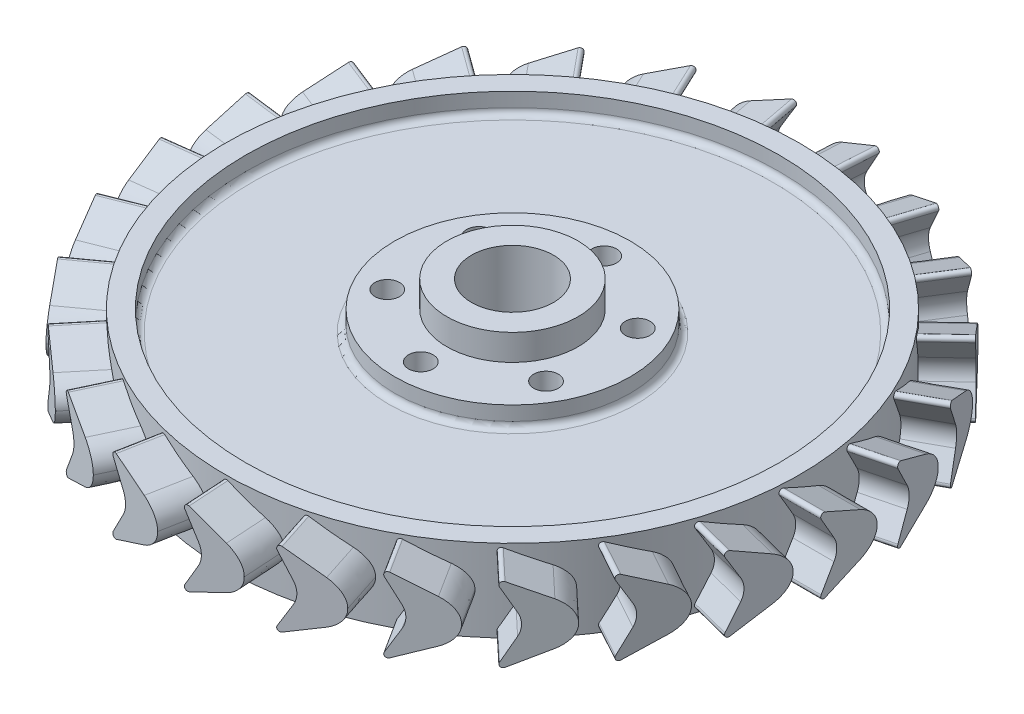
from build123d import *

# Parameters (mm, degrees)
HUB_FILLETS_R          = 0.762
F_4_0MM_DOWEL_HOLE1_D  = 3
CIRPATTERN1_COUNT      = 6
F_10_0MM_DOWEL_HOLE1_D = 10
BOSS_EXTRUDE2_START    = -2.5
BOSS_EXTRUDE2_DEPTH    = 7.5
FILLET1_R              = 0.381
CIRPATTERN3_START      = 34.716323972
CIRPATTERN3_DEPTH      = 5.283676028
CIRPATTERN3_2_DEPTH    = 5.283676028
CIRPATTERN3_3_DEPTH    = 5.283676028
CIRPATTERN3_4_DEPTH    = 5.283676028
CIRPATTERN3_5_DEPTH    = 5.283676028
CIRPATTERN3_6_DEPTH    = 5.283676028
CIRPATTERN3_START_2    = -40
CIRPATTERN3_7_DEPTH    = 5.283676028
CIRPATTERN3_8_DEPTH    = 5.283676028
CIRPATTERN3_9_DEPTH    = 5.283676028
CIRPATTERN3_10_DEPTH   = 5.283676028
CIRPATTERN3_11_DEPTH   = 5.283676028
CIRPATTERN3_12_DEPTH   = 5.283676028
CIRPATTERN3_13_DEPTH   = 5.283676028
CIRPATTERN3_14_DEPTH   = 5.283676028
CIRPATTERN3_15_DEPTH   = 5.283676028
CIRPATTERN3_16_DEPTH   = 5.283676028
CIRPATTERN3_17_DEPTH   = 5.283676028
CIRPATTERN3_18_DEPTH   = 5.283676028
CIRPATTERN3_19_DEPTH   = 5.283676028
CIRPATTERN3_20_DEPTH   = 5.283676028
CIRPATTERN3_21_DEPTH   = 5.283676028
CIRPATTERN3_22_DEPTH   = 5.283676028
CIRPATTERN3_23_DEPTH   = 5.283676028
CIRPATTERN3_24_DEPTH   = 5.283676028


# Read off the part's stored shape, not the designer's step: CirPattern3
with BuildPart() as part:
    # Sketch1 → Main Body (revolve)
    with BuildSketch(Plane.XY, mode=Mode.PRIVATE) as main_body_sk:
        Polygon((0, 0), (0, 10.000000066), (0, 13.175000066), (8.000000002, 13.175000066), (8.000000002, 10.000000066), (14.350000002, 10.000000066), (14.350000002, 7.499999986), (32.49999992, 7.499999986), (32.49999992, 10.000000033), (35, 10.000000033), (35, 3.3e-08), (32.49999992, 3.3e-08), (32.49999992, 2.50000008), (14.350000002, 2.50000008), (14.350000002, 0), align=None)
    revolve(main_body_sk.sketch.rotate(Axis((0, 0, 0), (0, 1, 0)), 90), axis=Axis((0, 0, 0), (0, 1, 0)))

    # Hub Fillets
    hub_fillets_edges = [part.edges().sort_by_distance(p)[0] for p in [
        (0, 2.50000008, 14.350000002),
        (0, 2.50000008, 32.49999992),
        (0, 7.499999986, 32.49999992),
        (0, 7.499999986, 14.350000002),
    ]]
    fillet(hub_fillets_edges, radius=HUB_FILLETS_R)

    # Ø4.0mm Dowel Hole1 (through all)
    with Locations(Plane(origin=(0, 0, 0), x_dir=(-1, 0, 0), z_dir=(0, -1, 0))):
        with Locations((0, 11.175)):
            f_4_0mm_dowel_hole1 = Hole(F_4_0MM_DOWEL_HOLE1_D / 2)

    # CirPattern1: Ø4.0mm Dowel Hole1 ×6 about axis
    cirpattern1_axis = Axis((0, 0, 0), (0, 1, 0))
    for i in range(1, CIRPATTERN1_COUNT):
        add(f_4_0mm_dowel_hole1.rotate(cirpattern1_axis, i * 360 / CIRPATTERN1_COUNT), mode=Mode.SUBTRACT)

    # Ø10.0mm Dowel Hole1 (through all)
    with Locations(Plane(origin=(0, 13.175000066, 0), x_dir=(1, 0, 0), z_dir=(0, 1, 0))):
        with Locations((0, 0)):
            Hole(F_10_0MM_DOWEL_HOLE1_D / 2)

    # Sketch11 → Boss-Extrude2 (add)
    with BuildSketch(Plane(origin=(35, 0, 0), x_dir=(0, 0, -1), z_dir=(1, 0, 0)).offset(BOSS_EXTRUDE2_START)):
        with BuildLine():
            Line((2.403420235, 7.617646397), (0, 8.682555307))
            Line((0, 8.682555307), (0, 4.997923122))
            Line((0, 4.997923122), (4.446875645, 4.997923122))
            add(Edge.make_bspline(
                [(2.403420235, 7.617646397), (3.185941814, 7.270926257), (4.467012766, 6.356428113), (4.446875645, 4.997923122)],
                knots=[0, 0, 0, 0, 1, 1, 1, 1], degree=3))
        make_face()
        with BuildLine():
            Line((4.446875645, 4.997923122), (0, 4.997923122))
            Line((0, 4.997923122), (0, 1.313290936))
            Line((0, 1.313290936), (2.403420235, 2.378199846))
            add(Edge.make_bspline(
                [(2.403420235, 2.378199846), (3.185941814, 2.724919986), (4.467012766, 3.63941813), (4.446875645, 4.997923122)],
                knots=[0, 0, 0, 0, 1, 1, 1, 1], degree=3))
        make_face()
        with BuildLine():
            Line((0, 1.313290936), (0, 4.997923122))
            Line((0, 4.997923122), (-0.475027622, 4.997923122))
            ThreePointArc((-0.475027622, 4.997923122), (-0.561114438, 4.342905398), (-0.813527978, 3.732375658))
            Line((-0.813527978, 3.732375658), (-2.964, 0))
            Line((-2.964, 0), (0, 1.313290936))
        make_face()
        with BuildLine():
            Line((0, 4.997923122), (0, 8.682555307))
            Line((0, 8.682555307), (-2.964, 9.995846243))
            Line((-2.964, 9.995846243), (-0.813527978, 6.263470586))
            ThreePointArc((-0.813527978, 6.263470586), (-0.561114438, 5.652940845), (-0.475027622, 4.997923122))
            Line((-0.475027622, 4.997923122), (0, 4.997923122))
        make_face()
    extrude(amount=BOSS_EXTRUDE2_DEPTH)

    # Fillet1
    fillet1_edges = [part.edges().sort_by_distance(p)[0] for p in [
        (37.437134971, 0, 2.964),
        (37.437134971, 9.995846243, 2.964),
    ]]
    fillet(fillet1_edges, radius=FILLET1_R)

    # CirPattern3 outline → CirPattern3 (add)
    with BuildSketch(Plane(origin=(0, 0, 0), x_dir=(0, 1, 0), z_dir=(0.9685831611286311, 0, 0.24868988716485502)).offset(CIRPATTERN3_START)):
        with BuildLine():
            add(Edge.make_bspline(
                [(7.617646397, -2.403420235), (7.270926257, -3.185941814), (6.356428113, -4.467012766), (4.997923122, -4.446875645)],
                knots=[0, 0, 0, 0, 1, 1, 1, 1], degree=3))
            Line((7.617646397, -2.403420235), (9.522989104, 1.896796593))
            ThreePointArc((9.522989104, 1.896796593), (9.429461244, 2.334392211), (8.984443836, 2.381263218))
            Line((8.984443836, 2.381263218), (6.263470588, 0.81352798))
            ThreePointArc((6.263470588, 0.81352798), (4.997923123, 0.475027622), (3.732375658, 0.813527978))
            Line((3.732375658, 0.813527978), (1.011402407, 2.381263218))
            ThreePointArc((1.011402407, 2.381263218), (0.566384999, 2.334392211), (0.472857139, 1.896796593))
            Line((0.472857139, 1.896796593), (2.378199846, -2.403420235))
            add(Edge.make_bspline(
                [(2.378199846, -2.403420235), (2.724919986, -3.185941814), (3.63941813, -4.467012766), (4.997923122, -4.446875645)],
                knots=[0, 0, 0, 0, 1, 1, 1, 1], degree=3))
        make_face()
    extrude(amount=CIRPATTERN3_DEPTH)

    # CirPattern3 2 outline → CirPattern3 2 (add)
    with BuildSketch(Plane(origin=(0, 0, 0), x_dir=(0.4817536741017157, 0, -0.8763066800438634), z_dir=(0.8763066800438633, 0, 0.4817536741017161)).offset(CIRPATTERN3_START)):
        with BuildLine():
            add(Edge.make_bspline(
                [(2.403420235, 7.617646397), (3.185941814, 7.270926257), (4.467012766, 6.356428113), (4.446875645, 4.997923122)],
                knots=[0, 0, 0, 0, 1, 1, 1, 1], degree=3))
            Line((2.403420235, 7.617646397), (-1.896796593, 9.522989104))
            ThreePointArc((-1.896796593, 9.522989104), (-2.334392211, 9.429461244), (-2.381263218, 8.984443836))
            Line((-2.381263218, 8.984443836), (-0.813527978, 6.263470586))
            ThreePointArc((-0.813527978, 6.263470586), (-0.475027622, 4.997923122), (-0.813527978, 3.732375658))
            Line((-0.813527978, 3.732375658), (-2.381263218, 1.011402407))
            ThreePointArc((-2.381263218, 1.011402407), (-2.334392211, 0.566384999), (-1.896796593, 0.472857139))
            Line((-1.896796593, 0.472857139), (2.403420235, 2.378199846))
            add(Edge.make_bspline(
                [(2.403420235, 2.378199846), (3.185941814, 2.724919986), (4.467012766, 3.63941813), (4.446875645, 4.997923122)],
                knots=[0, 0, 0, 0, 1, 1, 1, 1], degree=3))
        make_face()
    extrude(amount=CIRPATTERN3_2_DEPTH)

    # CirPattern3 3 outline → CirPattern3 3 (add)
    with BuildSketch(Plane(origin=(0, 0, 0), x_dir=(0.6845471059286901, 0, -0.7289686274214102), z_dir=(0.7289686274214102, 0, 0.6845471059286902)).offset(CIRPATTERN3_START)):
        with BuildLine():
            add(Edge.make_bspline(
                [(2.403420235, 7.617646397), (3.185941814, 7.270926257), (4.467012766, 6.356428113), (4.446875645, 4.997923122)],
                knots=[0, 0, 0, 0, 1, 1, 1, 1], degree=3))
            Line((2.403420235, 7.617646397), (-1.896796593, 9.522989104))
            ThreePointArc((-1.896796593, 9.522989104), (-2.334392211, 9.429461244), (-2.381263218, 8.984443836))
            Line((-2.381263218, 8.984443836), (-0.813527978, 6.263470586))
            ThreePointArc((-0.813527978, 6.263470586), (-0.475027622, 4.997923122), (-0.813527978, 3.732375658))
            Line((-0.813527978, 3.732375658), (-2.381263218, 1.011402407))
            ThreePointArc((-2.381263218, 1.011402407), (-2.334392211, 0.566384999), (-1.896796593, 0.472857139))
            Line((-1.896796593, 0.472857139), (2.403420235, 2.378199846))
            add(Edge.make_bspline(
                [(2.403420235, 2.378199846), (3.185941814, 2.724919986), (4.467012766, 3.63941813), (4.446875645, 4.997923122)],
                knots=[0, 0, 0, 0, 1, 1, 1, 1], degree=3))
        make_face()
    extrude(amount=CIRPATTERN3_3_DEPTH)

    # CirPattern3 4 outline → CirPattern3 4 (add)
    with BuildSketch(Plane(origin=(0, 0, 0), x_dir=(0.8443279255020161, 0, -0.5358267949789951), z_dir=(0.5358267949789951, 0, 0.8443279255020161)).offset(CIRPATTERN3_START)):
        with BuildLine():
            add(Edge.make_bspline(
                [(2.403420235, 7.617646397), (3.185941814, 7.270926257), (4.467012766, 6.356428113), (4.446875645, 4.997923122)],
                knots=[0, 0, 0, 0, 1, 1, 1, 1], degree=3))
            Line((2.403420235, 7.617646397), (-1.896796593, 9.522989104))
            ThreePointArc((-1.896796593, 9.522989104), (-2.334392211, 9.429461244), (-2.381263218, 8.984443836))
            Line((-2.381263218, 8.984443836), (-0.81352798, 6.263470588))
            ThreePointArc((-0.81352798, 6.263470588), (-0.475027622, 4.997923123), (-0.813527978, 3.732375658))
            Line((-0.813527978, 3.732375658), (-2.381263218, 1.011402407))
            ThreePointArc((-2.381263218, 1.011402407), (-2.334392211, 0.566384999), (-1.896796593, 0.472857139))
            Line((-1.896796593, 0.472857139), (2.403420235, 2.378199846))
            add(Edge.make_bspline(
                [(2.403420235, 2.378199846), (3.185941814, 2.724919986), (4.467012766, 3.63941813), (4.446875645, 4.997923122)],
                knots=[0, 0, 0, 0, 1, 1, 1, 1], degree=3))
        make_face()
    extrude(amount=CIRPATTERN3_4_DEPTH)

    # CirPattern3 5 outline → CirPattern3 5 (add)
    with BuildSketch(Plane(origin=(0, 0, 0), x_dir=(0.9510565162951544, 0, -0.30901699437494495), z_dir=(0.3090169943749449, 0, 0.9510565162951545)).offset(CIRPATTERN3_START)):
        with BuildLine():
            add(Edge.make_bspline(
                [(2.403420235, 7.617646397), (3.185941814, 7.270926257), (4.467012766, 6.356428113), (4.446875645, 4.997923122)],
                knots=[0, 0, 0, 0, 1, 1, 1, 1], degree=3))
            Line((2.403420235, 7.617646397), (-1.896796593, 9.522989104))
            ThreePointArc((-1.896796593, 9.522989104), (-2.334392211, 9.429461244), (-2.381263218, 8.984443836))
            Line((-2.381263218, 8.984443836), (-0.81352798, 6.263470588))
            ThreePointArc((-0.81352798, 6.263470588), (-0.475027622, 4.997923123), (-0.813527978, 3.732375658))
            Line((-0.813527978, 3.732375658), (-2.381263218, 1.011402407))
            ThreePointArc((-2.381263218, 1.011402407), (-2.334392211, 0.566384999), (-1.896796593, 0.472857139))
            Line((-1.896796593, 0.472857139), (2.403420235, 2.378199846))
            add(Edge.make_bspline(
                [(2.403420235, 2.378199846), (3.185941814, 2.724919986), (4.467012766, 3.63941813), (4.446875645, 4.997923122)],
                knots=[0, 0, 0, 0, 1, 1, 1, 1], degree=3))
        make_face()
    extrude(amount=CIRPATTERN3_5_DEPTH)

    # CirPattern3 6 outline → CirPattern3 6 (add)
    with BuildSketch(Plane(origin=(0, 0, 0), x_dir=(0.9980267284282718, 0, -0.06279051952930999), z_dir=(0.06279051952930999, 0, 0.9980267284282718)).offset(CIRPATTERN3_START)):
        with BuildLine():
            add(Edge.make_bspline(
                [(2.403420235, 7.617646397), (3.185941814, 7.270926257), (4.467012766, 6.356428113), (4.446875645, 4.997923122)],
                knots=[0, 0, 0, 0, 1, 1, 1, 1], degree=3))
            Line((2.403420235, 7.617646397), (-1.896796593, 9.522989104))
            ThreePointArc((-1.896796593, 9.522989104), (-2.334392211, 9.429461244), (-2.381263218, 8.984443836))
            Line((-2.381263218, 8.984443836), (-0.81352798, 6.263470588))
            ThreePointArc((-0.81352798, 6.263470588), (-0.475027622, 4.997923123), (-0.813527978, 3.732375658))
            Line((-0.813527978, 3.732375658), (-2.381263218, 1.011402407))
            ThreePointArc((-2.381263218, 1.011402407), (-2.334392211, 0.566384999), (-1.896796593, 0.472857139))
            Line((-1.896796593, 0.472857139), (2.403420235, 2.378199846))
            add(Edge.make_bspline(
                [(2.403420235, 2.378199846), (3.185941814, 2.724919986), (4.467012766, 3.63941813), (4.446875645, 4.997923122)],
                knots=[0, 0, 0, 0, 1, 1, 1, 1], degree=3))
        make_face()
    extrude(amount=CIRPATTERN3_6_DEPTH)

    # CirPattern3 7 outline → CirPattern3 7 (add)
    with BuildSketch(Plane(origin=(0, 0, 0), x_dir=(0.9822872507286879, 0, 0.18738131458572901), z_dir=(0.187381314585729, 0, -0.9822872507286879)).offset(CIRPATTERN3_START_2)):
        with BuildLine():
            Line((-1.896796593, -9.522989104), (2.403420235, -7.617646397))
            add(Edge.make_bspline(
                [(2.403420235, -7.617646397), (3.185941814, -7.270926257), (4.467012766, -6.356428113), (4.446875645, -4.997923122)],
                knots=[0, 0, 0, 0, 1, 1, 1, 1], degree=3))
            add(Edge.make_bspline(
                [(2.403420235, -2.378199846), (3.185941814, -2.724919986), (4.467012766, -3.63941813), (4.446875645, -4.997923122)],
                knots=[0, 0, 0, 0, 1, 1, 1, 1], degree=3))
            Line((2.403420235, -2.378199846), (-1.896796593, -0.472857139))
            ThreePointArc((-1.896796593, -0.472857139), (-2.334392211, -0.566384999), (-2.381263218, -1.011402407))
            Line((-2.381263218, -1.011402407), (-0.813527978, -3.732375658))
            ThreePointArc((-0.813527978, -3.732375658), (-0.475027622, -4.997923123), (-0.81352798, -6.263470588))
            Line((-0.81352798, -6.263470588), (-2.381263218, -8.984443836))
            ThreePointArc((-2.381263218, -8.984443836), (-2.334392211, -9.429461244), (-1.896796593, -9.522989104))
        make_face()
    extrude(amount=CIRPATTERN3_7_DEPTH)

    # CirPattern3 8 outline → CirPattern3 8 (add)
    with BuildSketch(Plane(origin=(0, 0, 0), x_dir=(0.9048270524660176, 0, 0.4257792915650768), z_dir=(0.4257792915650768, 0, -0.9048270524660176)).offset(CIRPATTERN3_START_2)):
        with BuildLine():
            Line((-1.896796593, -9.522989104), (2.403420235, -7.617646397))
            add(Edge.make_bspline(
                [(2.403420235, -7.617646397), (3.185941814, -7.270926257), (4.467012766, -6.356428113), (4.446875645, -4.997923122)],
                knots=[0, 0, 0, 0, 1, 1, 1, 1], degree=3))
            add(Edge.make_bspline(
                [(2.403420235, -2.378199846), (3.185941814, -2.724919986), (4.467012766, -3.63941813), (4.446875645, -4.997923122)],
                knots=[0, 0, 0, 0, 1, 1, 1, 1], degree=3))
            Line((2.403420235, -2.378199846), (-1.896796593, -0.472857139))
            ThreePointArc((-1.896796593, -0.472857139), (-2.334392211, -0.566384999), (-2.381263218, -1.011402407))
            Line((-2.381263218, -1.011402407), (-0.813527978, -3.732375658))
            ThreePointArc((-0.813527978, -3.732375658), (-0.475027622, -4.997923122), (-0.813527978, -6.263470586))
            Line((-0.813527978, -6.263470586), (-2.381263218, -8.984443836))
            ThreePointArc((-2.381263218, -8.984443836), (-2.334392211, -9.429461244), (-1.896796593, -9.522989104))
        make_face()
    extrude(amount=CIRPATTERN3_8_DEPTH)

    # CirPattern3 9 outline → CirPattern3 9 (add)
    with BuildSketch(Plane(origin=(0, 0, 0), x_dir=(0.7705132427757858, 0, 0.6374239897486939), z_dir=(0.6374239897486939, 0, -0.7705132427757858)).offset(CIRPATTERN3_START_2)):
        with BuildLine():
            Line((-1.896796593, -9.522989104), (2.403420235, -7.617646397))
            add(Edge.make_bspline(
                [(2.403420235, -7.617646397), (3.185941814, -7.270926257), (4.467012766, -6.356428113), (4.446875645, -4.997923122)],
                knots=[0, 0, 0, 0, 1, 1, 1, 1], degree=3))
            add(Edge.make_bspline(
                [(2.403420235, -2.378199846), (3.185941814, -2.724919986), (4.467012766, -3.63941813), (4.446875645, -4.997923122)],
                knots=[0, 0, 0, 0, 1, 1, 1, 1], degree=3))
            Line((2.403420235, -2.378199846), (-1.896796593, -0.472857139))
            ThreePointArc((-1.896796593, -0.472857139), (-2.334392211, -0.566384999), (-2.381263218, -1.011402407))
            Line((-2.381263218, -1.011402407), (-0.813527978, -3.732375658))
            ThreePointArc((-0.813527978, -3.732375658), (-0.475027622, -4.997923122), (-0.813527978, -6.263470586))
            Line((-0.813527978, -6.263470586), (-2.381263218, -8.984443836))
            ThreePointArc((-2.381263218, -8.984443836), (-2.334392211, -9.429461244), (-1.896796593, -9.522989104))
        make_face()
    extrude(amount=CIRPATTERN3_9_DEPTH)

    # CirPattern3 10 outline → CirPattern3 10 (add)
    with BuildSketch(Plane(origin=(0, 0, 0), x_dir=(0.5877852522924686, 0, 0.8090169943749507), z_dir=(0.8090169943749507, 0, -0.5877852522924688)).offset(CIRPATTERN3_START_2)):
        with BuildLine():
            Line((-1.896796593, -9.522989104), (2.403420235, -7.617646397))
            add(Edge.make_bspline(
                [(2.403420235, -7.617646397), (3.185941814, -7.270926257), (4.467012766, -6.356428113), (4.446875645, -4.997923122)],
                knots=[0, 0, 0, 0, 1, 1, 1, 1], degree=3))
            add(Edge.make_bspline(
                [(2.403420235, -2.378199846), (3.185941814, -2.724919986), (4.467012766, -3.63941813), (4.446875645, -4.997923122)],
                knots=[0, 0, 0, 0, 1, 1, 1, 1], degree=3))
            Line((2.403420235, -2.378199846), (-1.896796593, -0.472857139))
            ThreePointArc((-1.896796593, -0.472857139), (-2.334392211, -0.566384999), (-2.381263218, -1.011402407))
            Line((-2.381263218, -1.011402407), (-0.813527978, -3.732375658))
            ThreePointArc((-0.813527978, -3.732375658), (-0.475027622, -4.997923122), (-0.813527978, -6.263470586))
            Line((-0.813527978, -6.263470586), (-2.381263218, -8.984443836))
            ThreePointArc((-2.381263218, -8.984443836), (-2.334392211, -9.429461244), (-1.896796593, -9.522989104))
        make_face()
    extrude(amount=CIRPATTERN3_10_DEPTH)

    # CirPattern3 11 outline → CirPattern3 11 (add)
    with BuildSketch(Plane(origin=(0, 0, 0), x_dir=(0, 1, 0), z_dir=(0.9297764858882538, 0, -0.3681245526846719)).offset(CIRPATTERN3_START_2)):
        with BuildLine():
            Line((9.522989104, -1.896796593), (7.617646397, 2.403420235))
            add(Edge.make_bspline(
                [(7.617646397, 2.403420235), (7.270926257, 3.185941814), (6.356428113, 4.467012766), (4.997923122, 4.446875645)],
                knots=[0, 0, 0, 0, 1, 1, 1, 1], degree=3))
            add(Edge.make_bspline(
                [(2.378199846, 2.403420235), (2.724919986, 3.185941814), (3.63941813, 4.467012766), (4.997923122, 4.446875645)],
                knots=[0, 0, 0, 0, 1, 1, 1, 1], degree=3))
            Line((2.378199846, 2.403420235), (0.472857139, -1.896796593))
            ThreePointArc((0.472857139, -1.896796593), (0.566384999, -2.334392211), (1.011402407, -2.381263218))
            Line((1.011402407, -2.381263218), (3.732375658, -0.813527978))
            ThreePointArc((3.732375658, -0.813527978), (4.997923123, -0.475027622), (6.263470588, -0.81352798))
            Line((6.263470588, -0.81352798), (8.984443836, -2.381263218))
            ThreePointArc((8.984443836, -2.381263218), (9.429461244, -2.334392211), (9.522989104, -1.896796593))
        make_face()
    extrude(amount=CIRPATTERN3_11_DEPTH)

    # CirPattern3 12 outline → CirPattern3 12 (add)
    with BuildSketch(Plane(origin=(0, 0, 0), x_dir=(0, 1, 0), z_dir=(0.9921147013144788, 0, -0.12533323356429696)).offset(CIRPATTERN3_START_2)):
        with BuildLine():
            Line((9.522989104, -1.896796593), (7.617646397, 2.403420235))
            add(Edge.make_bspline(
                [(7.617646397, 2.403420235), (7.270926257, 3.185941814), (6.356428113, 4.467012766), (4.997923122, 4.446875645)],
                knots=[0, 0, 0, 0, 1, 1, 1, 1], degree=3))
            add(Edge.make_bspline(
                [(2.378199846, 2.403420235), (2.724919986, 3.185941814), (3.63941813, 4.467012766), (4.997923122, 4.446875645)],
                knots=[0, 0, 0, 0, 1, 1, 1, 1], degree=3))
            Line((2.378199846, 2.403420235), (0.472857139, -1.896796593))
            ThreePointArc((0.472857139, -1.896796593), (0.566384999, -2.334392211), (1.011402407, -2.381263218))
            Line((1.011402407, -2.381263218), (3.732375658, -0.813527978))
            ThreePointArc((3.732375658, -0.813527978), (4.997923123, -0.475027622), (6.263470588, -0.81352798))
            Line((6.263470588, -0.81352798), (8.984443836, -2.381263218))
            ThreePointArc((8.984443836, -2.381263218), (9.429461244, -2.334392211), (9.522989104, -1.896796593))
        make_face()
    extrude(amount=CIRPATTERN3_12_DEPTH)

    # CirPattern3 13 outline → CirPattern3 13 (add)
    with BuildSketch(Plane(origin=(0, 0, 0), x_dir=(0, 1, 0), z_dir=(0.992114701314477, 0, 0.125333233564311)).offset(CIRPATTERN3_START_2)):
        with BuildLine():
            Line((9.522989104, -1.896796593), (7.617646397, 2.403420235))
            add(Edge.make_bspline(
                [(7.617646397, 2.403420235), (7.270926257, 3.185941814), (6.356428113, 4.467012766), (4.997923122, 4.446875645)],
                knots=[0, 0, 0, 0, 1, 1, 1, 1], degree=3))
            add(Edge.make_bspline(
                [(2.378199846, 2.403420235), (2.724919986, 3.185941814), (3.63941813, 4.467012766), (4.997923122, 4.446875645)],
                knots=[0, 0, 0, 0, 1, 1, 1, 1], degree=3))
            Line((2.378199846, 2.403420235), (0.472857139, -1.896796593))
            ThreePointArc((0.472857139, -1.896796593), (0.566384999, -2.334392211), (1.011402407, -2.381263218))
            Line((1.011402407, -2.381263218), (3.732375658, -0.813527978))
            ThreePointArc((3.732375658, -0.813527978), (4.997923123, -0.475027622), (6.263470588, -0.81352798))
            Line((6.263470588, -0.81352798), (8.984443836, -2.381263218))
            ThreePointArc((8.984443836, -2.381263218), (9.429461244, -2.334392211), (9.522989104, -1.896796593))
        make_face()
    extrude(amount=CIRPATTERN3_13_DEPTH)

    # CirPattern3 14 outline → CirPattern3 14 (add)
    with BuildSketch(Plane(origin=(0, 0, 0), x_dir=(0, 1, 0), z_dir=(0.9297764858882486, 0, 0.36812455268468525)).offset(CIRPATTERN3_START_2)):
        with BuildLine():
            Line((9.522989104, -1.896796593), (7.617646397, 2.403420235))
            add(Edge.make_bspline(
                [(7.617646397, 2.403420235), (7.270926257, 3.185941814), (6.356428113, 4.467012766), (4.997923122, 4.446875645)],
                knots=[0, 0, 0, 0, 1, 1, 1, 1], degree=3))
            add(Edge.make_bspline(
                [(2.378199846, 2.403420235), (2.724919986, 3.185941814), (3.63941813, 4.467012766), (4.997923122, 4.446875645)],
                knots=[0, 0, 0, 0, 1, 1, 1, 1], degree=3))
            Line((2.378199846, 2.403420235), (0.472857139, -1.896796593))
            ThreePointArc((0.472857139, -1.896796593), (0.566384999, -2.334392211), (1.011402407, -2.381263218))
            Line((1.011402407, -2.381263218), (3.732375658, -0.813527978))
            ThreePointArc((3.732375658, -0.813527978), (4.997923123, -0.475027622), (6.263470588, -0.81352798))
            Line((6.263470588, -0.81352798), (8.984443836, -2.381263218))
            ThreePointArc((8.984443836, -2.381263218), (9.429461244, -2.334392211), (9.522989104, -1.896796593))
        make_face()
    extrude(amount=CIRPATTERN3_14_DEPTH)

    # CirPattern3 15 outline → CirPattern3 15 (add)
    with BuildSketch(Plane(origin=(0, 0, 0), x_dir=(0.58778525229248, 0, -0.8090169943749425), z_dir=(0.8090169943749423, 0, 0.5877852522924804)).offset(CIRPATTERN3_START_2)):
        with BuildLine():
            Line((1.896796593, 9.522989104), (-2.403420235, 7.617646397))
            add(Edge.make_bspline(
                [(-2.403420235, 7.617646397), (-3.185941814, 7.270926257), (-4.467012766, 6.356428113), (-4.446875645, 4.997923122)],
                knots=[0, 0, 0, 0, 1, 1, 1, 1], degree=3))
            add(Edge.make_bspline(
                [(-2.403420235, 2.378199846), (-3.185941814, 2.724919986), (-4.467012766, 3.63941813), (-4.446875645, 4.997923122)],
                knots=[0, 0, 0, 0, 1, 1, 1, 1], degree=3))
            Line((-2.403420235, 2.378199846), (1.896796593, 0.472857139))
            ThreePointArc((1.896796593, 0.472857139), (2.334392211, 0.566384999), (2.381263218, 1.011402407))
            Line((2.381263218, 1.011402407), (0.813527978, 3.732375658))
            ThreePointArc((0.813527978, 3.732375658), (0.475027622, 4.997923122), (0.813527978, 6.263470586))
            Line((0.813527978, 6.263470586), (2.381263218, 8.984443836))
            ThreePointArc((2.381263218, 8.984443836), (2.334392211, 9.429461244), (1.896796593, 9.522989104))
        make_face()
    extrude(amount=CIRPATTERN3_15_DEPTH)

    # CirPattern3 16 outline → CirPattern3 16 (add)
    with BuildSketch(Plane(origin=(0, 0, 0), x_dir=(0.7705132427757947, 0, -0.6374239897486831), z_dir=(0.637423989748683, 0, 0.7705132427757949)).offset(CIRPATTERN3_START_2)):
        with BuildLine():
            Line((1.896796593, 9.522989104), (-2.403420235, 7.617646397))
            add(Edge.make_bspline(
                [(-2.403420235, 7.617646397), (-3.185941814, 7.270926257), (-4.467012766, 6.356428113), (-4.446875645, 4.997923122)],
                knots=[0, 0, 0, 0, 1, 1, 1, 1], degree=3))
            add(Edge.make_bspline(
                [(-2.403420235, 2.378199846), (-3.185941814, 2.724919986), (-4.467012766, 3.63941813), (-4.446875645, 4.997923122)],
                knots=[0, 0, 0, 0, 1, 1, 1, 1], degree=3))
            Line((-2.403420235, 2.378199846), (1.896796593, 0.472857139))
            ThreePointArc((1.896796593, 0.472857139), (2.334392211, 0.566384999), (2.381263218, 1.011402407))
            Line((2.381263218, 1.011402407), (0.813527978, 3.732375658))
            ThreePointArc((0.813527978, 3.732375658), (0.475027622, 4.997923122), (0.813527978, 6.263470586))
            Line((0.813527978, 6.263470586), (2.381263218, 8.984443836))
            ThreePointArc((2.381263218, 8.984443836), (2.334392211, 9.429461244), (1.896796593, 9.522989104))
        make_face()
    extrude(amount=CIRPATTERN3_16_DEPTH)

    # CirPattern3 17 outline → CirPattern3 17 (add)
    with BuildSketch(Plane(origin=(0, 0, 0), x_dir=(0.9048270524660236, 0, -0.42577929156506394), z_dir=(0.4257792915650639, 0, 0.9048270524660238)).offset(CIRPATTERN3_START_2)):
        with BuildLine():
            Line((1.896796593, 9.522989104), (-2.403420235, 7.617646397))
            add(Edge.make_bspline(
                [(-2.403420235, 7.617646397), (-3.185941814, 7.270926257), (-4.467012766, 6.356428113), (-4.446875645, 4.997923122)],
                knots=[0, 0, 0, 0, 1, 1, 1, 1], degree=3))
            add(Edge.make_bspline(
                [(-2.403420235, 2.378199846), (-3.185941814, 2.724919986), (-4.467012766, 3.63941813), (-4.446875645, 4.997923122)],
                knots=[0, 0, 0, 0, 1, 1, 1, 1], degree=3))
            Line((-2.403420235, 2.378199846), (1.896796593, 0.472857139))
            ThreePointArc((1.896796593, 0.472857139), (2.334392211, 0.566384999), (2.381263218, 1.011402407))
            Line((2.381263218, 1.011402407), (0.813527978, 3.732375658))
            ThreePointArc((0.813527978, 3.732375658), (0.475027622, 4.997923123), (0.81352798, 6.263470588))
            Line((0.81352798, 6.263470588), (2.381263218, 8.984443836))
            ThreePointArc((2.381263218, 8.984443836), (2.334392211, 9.429461244), (1.896796593, 9.522989104))
        make_face()
    extrude(amount=CIRPATTERN3_17_DEPTH)

    # CirPattern3 18 outline → CirPattern3 18 (add)
    with BuildSketch(Plane(origin=(0, 0, 0), x_dir=(0.9822872507286906, 0, -0.1873813145857151), z_dir=(0.18738131458571508, 0, 0.9822872507286905)).offset(CIRPATTERN3_START_2)):
        with BuildLine():
            Line((1.896796593, 9.522989104), (-2.403420235, 7.617646397))
            add(Edge.make_bspline(
                [(-2.403420235, 7.617646397), (-3.185941814, 7.270926257), (-4.467012766, 6.356428113), (-4.446875645, 4.997923122)],
                knots=[0, 0, 0, 0, 1, 1, 1, 1], degree=3))
            add(Edge.make_bspline(
                [(-2.403420235, 2.378199846), (-3.185941814, 2.724919986), (-4.467012766, 3.63941813), (-4.446875645, 4.997923122)],
                knots=[0, 0, 0, 0, 1, 1, 1, 1], degree=3))
            Line((-2.403420235, 2.378199846), (1.896796593, 0.472857139))
            ThreePointArc((1.896796593, 0.472857139), (2.334392211, 0.566384999), (2.381263218, 1.011402407))
            Line((2.381263218, 1.011402407), (0.813527978, 3.732375658))
            ThreePointArc((0.813527978, 3.732375658), (0.475027622, 4.997923123), (0.81352798, 6.263470588))
            Line((0.81352798, 6.263470588), (2.381263218, 8.984443836))
            ThreePointArc((2.381263218, 8.984443836), (2.334392211, 9.429461244), (1.896796593, 9.522989104))
        make_face()
    extrude(amount=CIRPATTERN3_18_DEPTH)

    # CirPattern3 19 outline → CirPattern3 19 (add)
    with BuildSketch(Plane(origin=(0, 0, 0), x_dir=(0.9980267284282709, 0, 0.0627905195293244), z_dir=(0.0627905195293244, 0, -0.998026728428271)).offset(CIRPATTERN3_START)):
        with BuildLine():
            add(Edge.make_bspline(
                [(-2.403420235, -7.617646397), (-3.185941814, -7.270926257), (-4.467012766, -6.356428113), (-4.446875645, -4.997923122)],
                knots=[0, 0, 0, 0, 1, 1, 1, 1], degree=3))
            Line((-2.403420235, -7.617646397), (1.896796593, -9.522989104))
            ThreePointArc((1.896796593, -9.522989104), (2.334392211, -9.429461244), (2.381263218, -8.984443836))
            Line((2.381263218, -8.984443836), (0.81352798, -6.263470588))
            ThreePointArc((0.81352798, -6.263470588), (0.475027622, -4.997923123), (0.813527978, -3.732375658))
            Line((0.813527978, -3.732375658), (2.381263218, -1.011402407))
            ThreePointArc((2.381263218, -1.011402407), (2.334392211, -0.566384999), (1.896796593, -0.472857139))
            Line((1.896796593, -0.472857139), (-2.403420235, -2.378199846))
            add(Edge.make_bspline(
                [(-2.403420235, -2.378199846), (-3.185941814, -2.724919986), (-4.467012766, -3.63941813), (-4.446875645, -4.997923122)],
                knots=[0, 0, 0, 0, 1, 1, 1, 1], degree=3))
        make_face()
    extrude(amount=CIRPATTERN3_19_DEPTH)

    # CirPattern3 20 outline → CirPattern3 20 (add)
    with BuildSketch(Plane(origin=(0, 0, 0), x_dir=(0.9510565162951502, 0, 0.30901699437495805), z_dir=(0.30901699437495805, 0, -0.9510565162951502)).offset(CIRPATTERN3_START)):
        with BuildLine():
            add(Edge.make_bspline(
                [(-2.403420235, -7.617646397), (-3.185941814, -7.270926257), (-4.467012766, -6.356428113), (-4.446875645, -4.997923122)],
                knots=[0, 0, 0, 0, 1, 1, 1, 1], degree=3))
            Line((-2.403420235, -7.617646397), (1.896796593, -9.522989104))
            ThreePointArc((1.896796593, -9.522989104), (2.334392211, -9.429461244), (2.381263218, -8.984443836))
            Line((2.381263218, -8.984443836), (0.81352798, -6.263470588))
            ThreePointArc((0.81352798, -6.263470588), (0.475027622, -4.997923123), (0.813527978, -3.732375658))
            Line((0.813527978, -3.732375658), (2.381263218, -1.011402407))
            ThreePointArc((2.381263218, -1.011402407), (2.334392211, -0.566384999), (1.896796593, -0.472857139))
            Line((1.896796593, -0.472857139), (-2.403420235, -2.378199846))
            add(Edge.make_bspline(
                [(-2.403420235, -2.378199846), (-3.185941814, -2.724919986), (-4.467012766, -3.63941813), (-4.446875645, -4.997923122)],
                knots=[0, 0, 0, 0, 1, 1, 1, 1], degree=3))
        make_face()
    extrude(amount=CIRPATTERN3_20_DEPTH)

    # CirPattern3 21 outline → CirPattern3 21 (add)
    with BuildSketch(Plane(origin=(0, 0, 0), x_dir=(0.8443279255020086, 0, 0.5358267949790068), z_dir=(0.5358267949790068, 0, -0.8443279255020086)).offset(CIRPATTERN3_START)):
        with BuildLine():
            add(Edge.make_bspline(
                [(-2.403420235, -7.617646397), (-3.185941814, -7.270926257), (-4.467012766, -6.356428113), (-4.446875645, -4.997923122)],
                knots=[0, 0, 0, 0, 1, 1, 1, 1], degree=3))
            Line((-2.403420235, -7.617646397), (1.896796593, -9.522989104))
            ThreePointArc((1.896796593, -9.522989104), (2.334392211, -9.429461244), (2.381263218, -8.984443836))
            Line((2.381263218, -8.984443836), (0.813527978, -6.263470586))
            ThreePointArc((0.813527978, -6.263470586), (0.475027622, -4.997923122), (0.813527978, -3.732375658))
            Line((0.813527978, -3.732375658), (2.381263218, -1.011402407))
            ThreePointArc((2.381263218, -1.011402407), (2.334392211, -0.566384999), (1.896796593, -0.472857139))
            Line((1.896796593, -0.472857139), (-2.403420235, -2.378199846))
            add(Edge.make_bspline(
                [(-2.403420235, -2.378199846), (-3.185941814, -2.724919986), (-4.467012766, -3.63941813), (-4.446875645, -4.997923122)],
                knots=[0, 0, 0, 0, 1, 1, 1, 1], degree=3))
        make_face()
    extrude(amount=CIRPATTERN3_21_DEPTH)

    # CirPattern3 22 outline → CirPattern3 22 (add)
    with BuildSketch(Plane(origin=(0, 0, 0), x_dir=(0.6845471059286793, 0, 0.7289686274214203), z_dir=(0.7289686274214203, 0, -0.6845471059286793)).offset(CIRPATTERN3_START)):
        with BuildLine():
            add(Edge.make_bspline(
                [(-2.403420235, -7.617646397), (-3.185941814, -7.270926257), (-4.467012766, -6.356428113), (-4.446875645, -4.997923122)],
                knots=[0, 0, 0, 0, 1, 1, 1, 1], degree=3))
            Line((-2.403420235, -7.617646397), (1.896796593, -9.522989104))
            ThreePointArc((1.896796593, -9.522989104), (2.334392211, -9.429461244), (2.381263218, -8.984443836))
            Line((2.381263218, -8.984443836), (0.813527978, -6.263470586))
            ThreePointArc((0.813527978, -6.263470586), (0.475027622, -4.997923122), (0.813527978, -3.732375658))
            Line((0.813527978, -3.732375658), (2.381263218, -1.011402407))
            ThreePointArc((2.381263218, -1.011402407), (2.334392211, -0.566384999), (1.896796593, -0.472857139))
            Line((1.896796593, -0.472857139), (-2.403420235, -2.378199846))
            add(Edge.make_bspline(
                [(-2.403420235, -2.378199846), (-3.185941814, -2.724919986), (-4.467012766, -3.63941813), (-4.446875645, -4.997923122)],
                knots=[0, 0, 0, 0, 1, 1, 1, 1], degree=3))
        make_face()
    extrude(amount=CIRPATTERN3_22_DEPTH)

    # CirPattern3 23 outline → CirPattern3 23 (add)
    with BuildSketch(Plane(origin=(0, 0, 0), x_dir=(0.48175367410170367, 0, 0.87630668004387), z_dir=(0.8763066800438699, 0, -0.48175367410170394)).offset(CIRPATTERN3_START)):
        with BuildLine():
            add(Edge.make_bspline(
                [(-2.403420235, -7.617646397), (-3.185941814, -7.270926257), (-4.467012766, -6.356428113), (-4.446875645, -4.997923122)],
                knots=[0, 0, 0, 0, 1, 1, 1, 1], degree=3))
            Line((-2.403420235, -7.617646397), (1.896796593, -9.522989104))
            ThreePointArc((1.896796593, -9.522989104), (2.334392211, -9.429461244), (2.381263218, -8.984443836))
            Line((2.381263218, -8.984443836), (0.81352798, -6.263470588))
            ThreePointArc((0.81352798, -6.263470588), (0.475027622, -4.997923123), (0.813527978, -3.732375658))
            Line((0.813527978, -3.732375658), (2.381263218, -1.011402407))
            ThreePointArc((2.381263218, -1.011402407), (2.334392211, -0.566384999), (1.896796593, -0.472857139))
            Line((1.896796593, -0.472857139), (-2.403420235, -2.378199846))
            add(Edge.make_bspline(
                [(-2.403420235, -2.378199846), (-3.185941814, -2.724919986), (-4.467012766, -3.63941813), (-4.446875645, -4.997923122)],
                knots=[0, 0, 0, 0, 1, 1, 1, 1], degree=3))
        make_face()
    extrude(amount=CIRPATTERN3_23_DEPTH)

    # CirPattern3 24 outline → CirPattern3 24 (add)
    with BuildSketch(Plane(origin=(0, 0, 0), x_dir=(0, 1, 0), z_dir=(0.9685831611286345, 0, -0.2486898871648419)).offset(CIRPATTERN3_START)):
        with BuildLine():
            add(Edge.make_bspline(
                [(7.617646397, -2.403420235), (7.270926257, -3.185941814), (6.356428113, -4.467012766), (4.997923122, -4.446875645)],
                knots=[0, 0, 0, 0, 1, 1, 1, 1], degree=3))
            Line((7.617646397, -2.403420235), (9.522989104, 1.896796593))
            ThreePointArc((9.522989104, 1.896796593), (9.429461244, 2.334392211), (8.984443836, 2.381263218))
            Line((8.984443836, 2.381263218), (6.263470588, 0.81352798))
            ThreePointArc((6.263470588, 0.81352798), (4.997923123, 0.475027622), (3.732375658, 0.813527978))
            Line((3.732375658, 0.813527978), (1.011402407, 2.381263218))
            ThreePointArc((1.011402407, 2.381263218), (0.566384999, 2.334392211), (0.472857139, 1.896796593))
            Line((0.472857139, 1.896796593), (2.378199846, -2.403420235))
            add(Edge.make_bspline(
                [(2.378199846, -2.403420235), (2.724919986, -3.185941814), (3.63941813, -4.467012766), (4.997923122, -4.446875645)],
                knots=[0, 0, 0, 0, 1, 1, 1, 1], degree=3))
        make_face()
    extrude(amount=CIRPATTERN3_24_DEPTH)


solid = part.part
